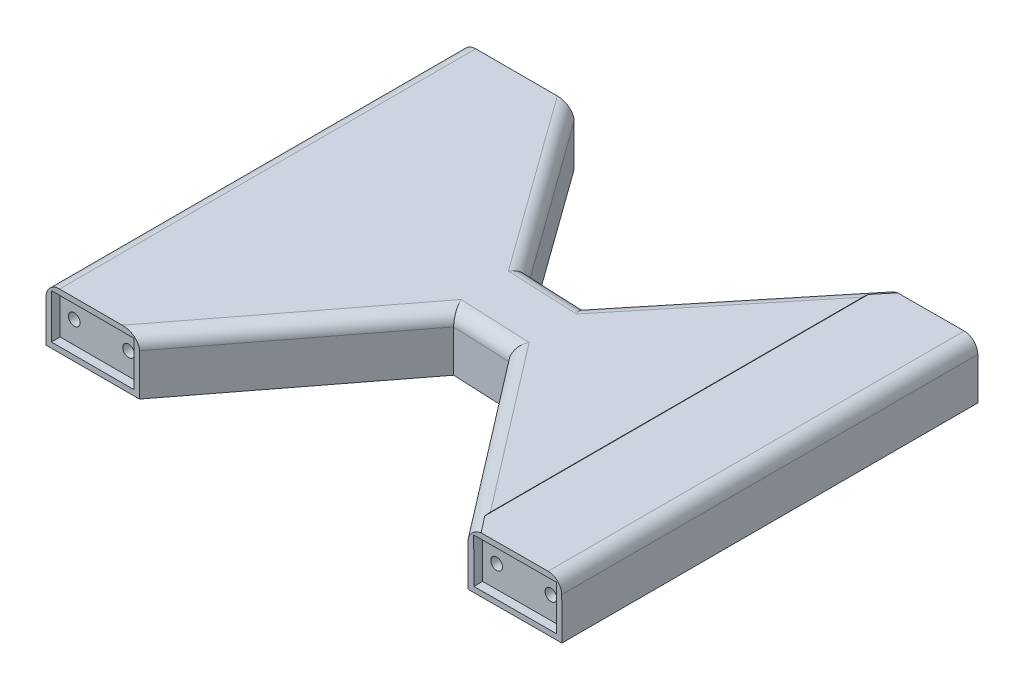
from build123d import *

# Parameters (mm, degrees)
SKETCH1_W             = 34.4
SKETCH1_H             = 20.4
SKETCH1_W_2           = 30.4
SKETCH1_H_2           = 16.4
BOSS_EXTRUDE1_DEPTH   = 3.2
BOSS_EXTRUDE1_2_DEPTH = 3.2
SKETCH4_W             = 34.4
SKETCH4_H             = 20.4
BOSS_EXTRUDE2_DEPTH   = 150
SKETCH5_W             = 30.4
SKETCH5_H             = 16.4
CUT_EXTRUDE2_DEPTH    = 3.2
BOSS_EXTRUDE4_REACH   = 221.091
SKETCH13_W            = 153.2
SKETCH13_H            = 20.4
CUT_EXTRUDE3_DEPTH    = 20.4
FILLET1_R             = 5
SKETCH2_R             = 2.15
CUT_EXTRUDE5_DEPTH    = 147


with BuildPart() as part:
    # Sketch1 → Boss-Extrude1 (new body)
    with BuildSketch(Plane.XY):
        with Locations((-13.13286664, 8.093964388)):
            Rectangle(SKETCH1_W, SKETCH1_H)
        with Locations((-13.13286664, 8.093964388)):
            Rectangle(SKETCH1_W_2, SKETCH1_H_2, mode=Mode.SUBTRACT)
    extrude(amount=BOSS_EXTRUDE1_DEPTH)



with BuildPart() as body_2:
    # Sketch1 → Boss-Extrude1 2 (new body)
    with BuildSketch(Plane.XY):
        Polygon((125.217994466, -2.2727378), (159.617685817, -2.127015635), (159.531269184, 18.272801329), (125.131577833, 18.127079165), align=None)
        Polygon((127.209504302, -0.264283525), (157.609231543, -0.135505799), (157.539759348, 16.264347055), (127.140032108, 16.135569328), align=None, mode=Mode.SUBTRACT)
    extrude(amount=BOSS_EXTRUDE1_2_DEPTH)


with BuildPart() as part_1:
    add(part.part)

    add(body_2.part)  # Boss-Extrude2 merges body 2
    # Sketch4 → Boss-Extrude2 (add)
    with BuildSketch(Plane.XY.offset(3.2)):
        with Locations((-13.13286664, 8.093964388)):
            Rectangle(SKETCH4_W, SKETCH4_H)
        Polygon((125.131577833, 18.127079165), (125.217994466, -2.2727378), (159.617685817, -2.127015635), (159.531269184, 18.272801329), align=None)
    extrude(amount=BOSS_EXTRUDE2_DEPTH)

    # Sketch5 → Cut-Extrude2 (cut)
    with BuildSketch(Plane.XY.offset(153.2)):
        with Locations((-13.13286664, 8.093964388)):
            Rectangle(SKETCH5_W, SKETCH5_H)
        Polygon((157.539759348, 16.264347055), (127.140032108, 16.135569328), (127.209504302, -0.264283525), (157.609231543, -0.135505799), align=None)
    extrude(amount=-CUT_EXTRUDE2_DEPTH, mode=Mode.SUBTRACT)

    # Boss-Extrude4: up to this face of the body (flat: up to its plane)
    boss_extrude4_end = Plane(part_1.part.faces().sort_by_distance((125.17478615, 7.927170683, 76.6))[0])
    # Sketch13 → Boss-Extrude4 (add, up to the picked face)
    with BuildSketch(Plane(origin=(4.06713336, 0, 0), x_dir=(0, 0, -1), z_dir=(1, 0, 0)), mode=Mode.PRIVATE) as boss_extrude4_sk1:
        with Locations((-76.6, 8.093964388)):
            Rectangle(SKETCH13_W, SKETCH13_H)
    boss_extrude4_tool1 = split(extrude(boss_extrude4_sk1.sketch, amount=BOSS_EXTRUDE4_REACH, mode=Mode.PRIVATE), bisect_by=boss_extrude4_end, keep=Keep.BOTH, mode=Mode.PRIVATE)
    add(boss_extrude4_tool1.solids().sort_by(Axis((4.067133, 8.093964, 76.6), (1, 0, 0)))[0])

    # Sketch14 → Cut-Extrude3 (cut)
    with BuildSketch(Plane(origin=(0, 18.293964388, 0), x_dir=(1, 0, 0), z_dir=(0, 1, 0))):
        Polygon((4.06713336, -153.2), (64.581899601, -153.2), (64.581899601, -88.198965672), (54.291599005, -87.746202034), align=None)
        Polygon((64.581899601, -88.198965672), (64.581899601, -153.2), (125.096665842, -153.2), (75.591314205, -88.683369655), align=None)
        Polygon((64.581899601, 0), (64.581899601, -60.434510767), (75.513081453, -60.915472582), (125.130870883, 0), align=None)
        Polygon((54.213366253, -59.978304961), (64.581899601, -60.434510767), (64.581899601, 0), (10.898373068, 0), align=None)
    extrude(amount=-CUT_EXTRUDE3_DEPTH, mode=Mode.SUBTRACT)

    # Fillet1
    # the kernel refuses this fillet: 5 mm, written as the material it takes off along each edge
    with BuildSketch(Plane(origin=(132.706183705, 18.293964388, 163.116916754), x_dir=(0.7933533402912364, 0, -0.6087614290087192), z_dir=(-0.6087614290087191, 0, -0.7933533402912364))) as fillet1_piece_1_section:
        with BuildLine():
            CenterArc((FILLET1_R, FILLET1_R), FILLET1_R, 180, 90)
            Line((0, FILLET1_R), (0, 0))
            Line((0, 0), (FILLET1_R, 0))
        make_face()
    fillet1_piece_1 = extrude(amount=106.321432794, mode=Mode.PRIVATE)
    fillet1_piece_1 = split(fillet1_piece_1, bisect_by=Plane(origin=(106.88840911, 17.155782702, 90.060412668), z_dir=(-0.04395654061558545, 0, 0.999033444153453)), keep=Keep.TOP, mode=Mode.PRIVATE)
    add(fillet1_piece_1, mode=Mode.SUBTRACT)
    with BuildSketch(Plane(origin=(41.803680953, 18.293964388, 87.196745277), x_dir=(0.0439565406155861, 0, -0.9990334441534529), z_dir=(0.999033444153453, 0, 0.043956540615586105))) as fillet1_piece_2_section:
        with BuildLine():
            CenterArc((FILLET1_R, -FILLET1_R), FILLET1_R, 90, 90)
            Line((0, -FILLET1_R), (0, 0))
            Line((0, 0), (FILLET1_R, 0))
        make_face()
    fillet1_piece_2 = extrude(amount=46.320322483, mode=Mode.PRIVATE)
    fillet1_piece_2 = split(fillet1_piece_2, bisect_by=Plane(origin=(58.505653555, 17.10801654, 82.254339222), z_dir=(0.7933533402912364, 0, 0.6087614290087192)), keep=Keep.TOP, mode=Mode.PRIVATE)
    fillet1_piece_2 = split(fillet1_piece_2, bisect_by=Plane(origin=(70.904619218, 17.10801654, 82.575549833), z_dir=(-0.7933533402912364, 0, 0.6087614290087191)), keep=Keep.TOP, mode=Mode.PRIVATE)
    add(fillet1_piece_2, mode=Mode.SUBTRACT)
    with BuildSketch(Plane(origin=(61.901116868, 18.293964388, 77.829285281), x_dir=(-0.7933533402912364, 0, -0.6087614290087192), z_dir=(-0.6087614290087192, 0, 0.7933533402912364))) as fillet1_piece_3_section:
        with BuildLine():
            CenterArc((FILLET1_R, FILLET1_R), FILLET1_R, 180, 90)
            Line((0, FILLET1_R), (0, 0))
            Line((0, 0), (FILLET1_R, 0))
        make_face()
    fillet1_piece_3 = extrude(amount=107.502706728, mode=Mode.PRIVATE)
    fillet1_piece_3 = split(fillet1_piece_3, bisect_by=Plane(origin=(25.940785784, 17.156890776, 86.498792671), z_dir=(-0.04395654061558545, 0, 0.999033444153453)), keep=Keep.TOP, mode=Mode.PRIVATE)
    add(fillet1_piece_3, mode=Mode.SUBTRACT)
    with BuildSketch(Plane(origin=(67.618799022, 18.293964388, 70.607237381), x_dir=(0.7753411838603286, 0, 0.6315425944542964), z_dir=(0.6315425944542965, 0, -0.7753411838603287))) as fillet1_piece_4_section:
        with BuildLine():
            CenterArc((FILLET1_R, FILLET1_R), FILLET1_R, 180, 90)
            Line((0, FILLET1_R), (0, 0))
            Line((0, 0), (FILLET1_R, 0))
        make_face()
    fillet1_piece_4 = extrude(amount=103.566022095, mode=Mode.PRIVATE)
    fillet1_piece_4 = split(fillet1_piece_4, bisect_by=Plane(origin=(103.811838578, 17.156329457, 62.160591526), z_dir=(0.04395654061558577, 0, -0.999033444153453)), keep=Keep.TOP, mode=Mode.PRIVATE)
    add(fillet1_piece_4, mode=Mode.SUBTRACT)
    with BuildSketch(Plane(origin=(41.725448201, 18.293964388, 59.428848203), x_dir=(-0.043956540615586105, 0, 0.9990334441534529), z_dir=(0.999033444153453, 0, 0.043956540615586105))) as fillet1_piece_5_section:
        with BuildLine():
            CenterArc((FILLET1_R, FILLET1_R), FILLET1_R, 180, 90)
            Line((0, FILLET1_R), (0, 0))
            Line((0, 0), (FILLET1_R, 0))
        make_face()
    fillet1_piece_5 = extrude(amount=46.320322483, mode=Mode.PRIVATE)
    fillet1_piece_5 = split(fillet1_piece_5, bisect_by=Plane(origin=(58.573091319, 17.108176182, 66.015219672), z_dir=(0.8106963672203948, 0, -0.5854668224380052)), keep=Keep.TOP, mode=Mode.PRIVATE)
    fillet1_piece_5 = split(fillet1_piece_5, bisect_by=Plane(origin=(70.976745321, 17.108176182, 66.484706167), z_dir=(-0.7753411838603287, 0, -0.6315425944542965)), keep=Keep.TOP, mode=Mode.PRIVATE)
    add(fillet1_piece_5, mode=Mode.SUBTRACT)
    with BuildSketch(Plane(origin=(3.580037788, 18.293964388, -10.13370459), x_dir=(-0.810696367220395, 0, 0.5854668224380052), z_dir=(0.5854668224380052, 0, 0.8106963672203948))) as fillet1_piece_6_section:
        with BuildLine():
            CenterArc((FILLET1_R, FILLET1_R), FILLET1_R, 180, 90)
            Line((0, FILLET1_R), (0, 0))
            Line((0, 0), (FILLET1_R, 0))
        make_face()
    fillet1_piece_6 = extrude(amount=98.983685368, mode=Mode.PRIVATE)
    fillet1_piece_6 = split(fillet1_piece_6, bisect_by=Plane(origin=(26.252750118, 17.155642398, 58.748063906), z_dir=(0.04395654061558577, 0, -0.999033444153453)), keep=Keep.TOP, mode=Mode.PRIVATE)
    add(fillet1_piece_6, mode=Mode.SUBTRACT)
    with BuildSketch(Plane(origin=(159.531269184, 18.272801329, -12.5), x_dir=(0.004236109424476813, -0.9999910276482205, 0), z_dir=(0, 0, 1))) as fillet1_piece_7:
        with BuildLine():
            CenterArc((FILLET1_R, -FILLET1_R), FILLET1_R, 90, 90)
            Line((0, -FILLET1_R), (0, 0))
            Line((0, 0), (FILLET1_R, 0))
        make_face()
    extrude(amount=178.2, mode=Mode.SUBTRACT)
    with BuildSketch(Plane(origin=(-30.33286664, 18.293964388, 165.7), x_dir=(1, 0, 0), z_dir=(0, 0, -1))) as fillet1_piece_8:
        with BuildLine():
            CenterArc((FILLET1_R, FILLET1_R), FILLET1_R, 180, 90)
            Line((0, FILLET1_R), (0, 0))
            Line((0, 0), (FILLET1_R, 0))
        make_face()
    extrude(amount=178.2, mode=Mode.SUBTRACT)
    with BuildSketch(Plane(origin=(41.803680953, 18.293964388, 87.196745277), x_dir=(0.0439565406155861, 0, -0.9990334441534529), z_dir=(0.999033444153453, 0, 0.043956540615586105))) as fillet1_piece_9a_section:
        with BuildLine():
            CenterArc((FILLET1_R, -FILLET1_R), FILLET1_R, 90, 90)
            Line((0, -FILLET1_R), (0, 0))
            Line((0, 0), (FILLET1_R, 0))
        make_face()
    fillet1_piece_9a = extrude(amount=46.320322483, mode=Mode.PRIVATE)
    fillet1_piece_9a = split(fillet1_piece_9a, bisect_by=Plane(origin=(77.278437613, 17.204839872, 90.882071688), z_dir=(0.7933533402912364, 0, -0.6087614290087191)), keep=Keep.TOP, mode=Mode.PRIVATE)
    with BuildSketch(Plane(origin=(132.706183705, 18.293964388, 163.116916754), x_dir=(0.7933533402912364, 0, -0.6087614290087192), z_dir=(-0.6087614290087191, 0, -0.7933533402912364))) as fillet1_piece_9b_section:
        with BuildLine():
            CenterArc((FILLET1_R, FILLET1_R), FILLET1_R, 180, 90)
            Line((0, FILLET1_R), (0, 0))
            Line((0, 0), (FILLET1_R, 0))
        make_face()
    fillet1_piece_9b = extrude(amount=106.321432794, mode=Mode.PRIVATE)
    fillet1_piece_9b = split(fillet1_piece_9b, bisect_by=Plane(origin=(72.822589663, 17.204839872, 88.561548356), z_dir=(0.04395654061558545, 0, -0.999033444153453)), keep=Keep.TOP, mode=Mode.PRIVATE)
    fillet1_piece_9 = fillet1_piece_9a & fillet1_piece_9b
    add(fillet1_piece_9, mode=Mode.SUBTRACT)
    with BuildSketch(Plane(origin=(61.901116868, 18.293964388, 77.829285281), x_dir=(-0.7933533402912364, 0, -0.6087614290087192), z_dir=(-0.6087614290087192, 0, 0.7933533402912364))) as fillet1_piece_10a_section:
        with BuildLine():
            CenterArc((FILLET1_R, FILLET1_R), FILLET1_R, 180, 90)
            Line((0, FILLET1_R), (0, 0))
            Line((0, 0), (FILLET1_R, 0))
        make_face()
    fillet1_piece_10a = extrude(amount=107.502706728, mode=Mode.PRIVATE)
    fillet1_piece_10a = split(fillet1_piece_10a, bisect_by=Plane(origin=(56.655534386, 17.19812243, 87.850212988), z_dir=(0.04395654061558545, 0, -0.999033444153453)), keep=Keep.TOP, mode=Mode.PRIVATE)
    with BuildSketch(Plane(origin=(41.803680953, 18.293964388, 87.196745277), x_dir=(0.0439565406155861, 0, -0.9990334441534529), z_dir=(0.999033444153453, 0, 0.043956540615586105))) as fillet1_piece_10b_section:
        with BuildLine():
            CenterArc((FILLET1_R, -FILLET1_R), FILLET1_R, 90, 90)
            Line((0, -FILLET1_R), (0, 0))
            Line((0, 0), (FILLET1_R, 0))
        make_face()
    fillet1_piece_10b = extrude(amount=46.320322483, mode=Mode.PRIVATE)
    fillet1_piece_10b = split(fillet1_piece_10b, bisect_by=Plane(origin=(52.851134035, 17.19812243, 89.623452533), z_dir=(-0.7933533402912364, 0, -0.6087614290087192)), keep=Keep.TOP, mode=Mode.PRIVATE)
    fillet1_piece_10 = fillet1_piece_10a & fillet1_piece_10b
    add(fillet1_piece_10, mode=Mode.SUBTRACT)
    with BuildSketch(Plane(origin=(67.618799022, 18.293964388, 70.607237381), x_dir=(0.7753411838603286, 0, 0.6315425944542964), z_dir=(0.6315425944542965, 0, -0.7753411838603287))) as fillet1_piece_11a_section:
        with BuildLine():
            CenterArc((FILLET1_R, FILLET1_R), FILLET1_R, 180, 90)
            Line((0, FILLET1_R), (0, 0))
            Line((0, 0), (FILLET1_R, 0))
        make_face()
    fillet1_piece_11a = extrude(amount=103.566022095, mode=Mode.PRIVATE)
    fillet1_piece_11a = split(fillet1_piece_11a, bisect_by=Plane(origin=(73.01107528, 17.200259545, 60.805386642), z_dir=(-0.04395654061558577, 0, 0.999033444153453)), keep=Keep.TOP, mode=Mode.PRIVATE)
    with BuildSketch(Plane(origin=(41.725448201, 18.293964388, 59.428848203), x_dir=(-0.043956540615586105, 0, 0.9990334441534529), z_dir=(0.999033444153453, 0, 0.043956540615586105))) as fillet1_piece_11b_section:
        with BuildLine():
            CenterArc((FILLET1_R, FILLET1_R), FILLET1_R, 180, 90)
            Line((0, FILLET1_R), (0, 0))
            Line((0, 0), (FILLET1_R, 0))
        make_face()
    fillet1_piece_11b = extrude(amount=46.320322483, mode=Mode.PRIVATE)
    fillet1_piece_11b = split(fillet1_piece_11b, bisect_by=Plane(origin=(77.094733678, 17.200259545, 58.97368731), z_dir=(0.7753411838603287, 0, 0.6315425944542965)), keep=Keep.TOP, mode=Mode.PRIVATE)
    fillet1_piece_11 = fillet1_piece_11a & fillet1_piece_11b
    add(fillet1_piece_11, mode=Mode.SUBTRACT)
    with BuildSketch(Plane(origin=(41.725448201, 18.293964388, 59.428848203), x_dir=(-0.043956540615586105, 0, 0.9990334441534529), z_dir=(0.999033444153453, 0, 0.043956540615586105))) as fillet1_piece_12a_section:
        with BuildLine():
            CenterArc((FILLET1_R, FILLET1_R), FILLET1_R, 180, 90)
            Line((0, FILLET1_R), (0, 0))
            Line((0, 0), (FILLET1_R, 0))
        make_face()
    fillet1_piece_12a = extrude(amount=46.320322483, mode=Mode.PRIVATE)
    fillet1_piece_12a = split(fillet1_piece_12a, bisect_by=Plane(origin=(52.666515046, 17.202537245, 57.836378885), z_dir=(-0.8106963672203948, 0, 0.5854668224380052)), keep=Keep.TOP, mode=Mode.PRIVATE)
    with BuildSketch(Plane(origin=(3.580037788, 18.293964388, -10.13370459), x_dir=(-0.810696367220395, 0, 0.5854668224380052), z_dir=(0.5854668224380052, 0, 0.8106963672203948))) as fillet1_piece_12b_section:
        with BuildLine():
            CenterArc((FILLET1_R, FILLET1_R), FILLET1_R, 180, 90)
            Line((0, FILLET1_R), (0, 0))
            Line((0, 0), (FILLET1_R, 0))
        make_face()
    fillet1_piece_12b = extrude(amount=98.983685368, mode=Mode.PRIVATE)
    fillet1_piece_12b = split(fillet1_piece_12b, bisect_by=Plane(origin=(56.852894283, 17.202537245, 60.094441735), z_dir=(-0.04395654061558577, 0, 0.999033444153453)), keep=Keep.TOP, mode=Mode.PRIVATE)
    fillet1_piece_12 = fillet1_piece_12a & fillet1_piece_12b
    add(fillet1_piece_12, mode=Mode.SUBTRACT)

    # Sketch2 → Cut-Extrude5 (cut)
    with BuildSketch(Plane.XY.offset(3)):
        with Locations((-23.13286664, 8.093964388)):
            Circle(SKETCH2_R)
        with Locations((-3.13286664, 8.093964388)):
            Circle(SKETCH2_R)
        with Locations((132.374721549, 7.95767067)):
            Circle(SKETCH2_R)
        with Locations((152.374542102, 8.042392859)):
            Circle(SKETCH2_R)
    extrude(amount=CUT_EXTRUDE5_DEPTH, mode=Mode.SUBTRACT)


solid = part_1.part
